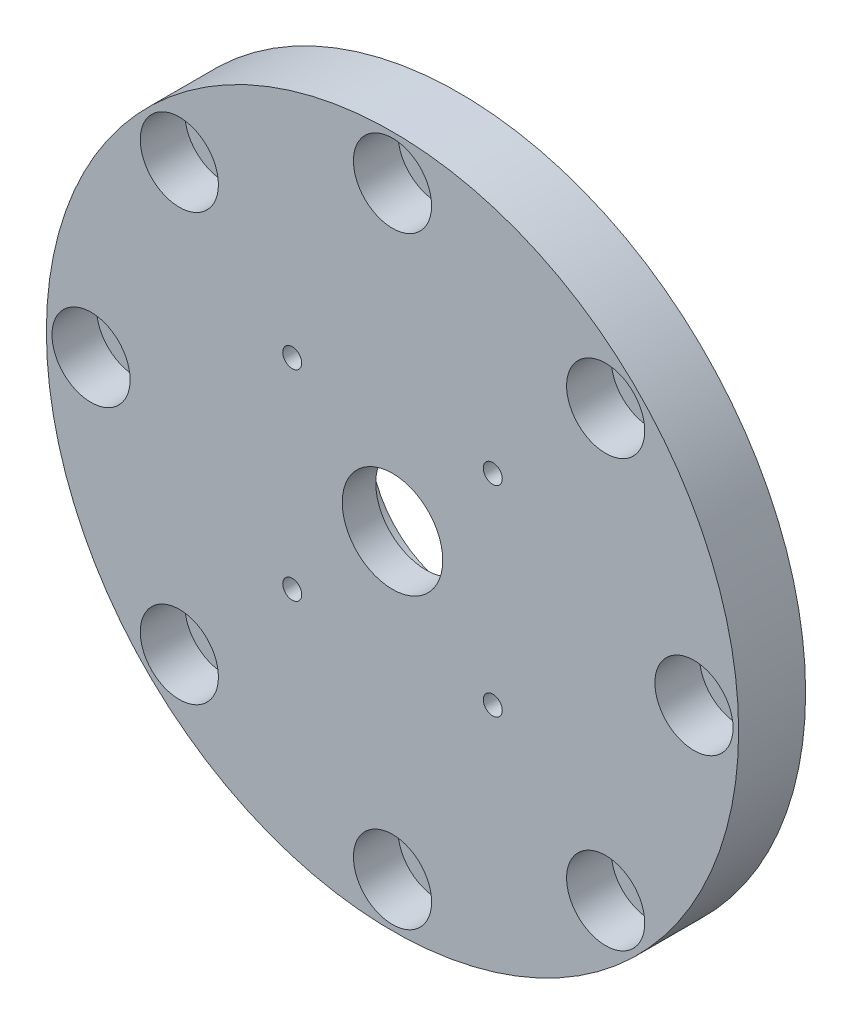
from build123d import *

# Parameters (mm, degrees)
SKETCH1_R           = 31
SKETCH1_R_2         = 4.5
SKETCH1_R_3         = 0.85
SKETCH1_R_4         = 1.55
BOSS_EXTRUDE2_DEPTH = 6
SKETCH5_R           = 8
CUT_EXTRUDE3_DEPTH  = 3
SKETCH6_R           = 3.5
CUT_EXTRUDE4_DEPTH  = 4
CUT_EXTRUDE5_DEPTH  = 2


with BuildPart() as part:
    # Sketch1 → Boss-Extrude2 (new body)
    with BuildSketch(Plane.XY):
        Circle(SKETCH1_R)
        Circle(SKETCH1_R_2, mode=Mode.SUBTRACT)
        with Locations((8.980256121, 8.980256121)):
            Circle(SKETCH1_R_3, mode=Mode.SUBTRACT)
        with Locations((8.980256121, -8.980256121)):
            Circle(SKETCH1_R_3, mode=Mode.SUBTRACT)
        with Locations((-8.980256121, -8.980256121)):
            Circle(SKETCH1_R_3, mode=Mode.SUBTRACT)
        with Locations((-8.980256121, 8.980256121)):
            Circle(SKETCH1_R_3, mode=Mode.SUBTRACT)
        with Locations((-27, 0)):
            Circle(SKETCH1_R_4, mode=Mode.SUBTRACT)
        with Locations((-19.091883092, 19.091883092)):
            Circle(SKETCH1_R_4, mode=Mode.SUBTRACT)
        with Locations((0, 27)):
            Circle(SKETCH1_R_4, mode=Mode.SUBTRACT)
        with Locations((19.091883092, 19.091883092)):
            Circle(SKETCH1_R_4, mode=Mode.SUBTRACT)
        with Locations((27, 0)):
            Circle(SKETCH1_R_4, mode=Mode.SUBTRACT)
        with Locations((19.091883092, -19.091883092)):
            Circle(SKETCH1_R_4, mode=Mode.SUBTRACT)
        with Locations((0, -27)):
            Circle(SKETCH1_R_4, mode=Mode.SUBTRACT)
        with Locations((-19.091883092, -19.091883092)):
            Circle(SKETCH1_R_4, mode=Mode.SUBTRACT)
    extrude(amount=BOSS_EXTRUDE2_DEPTH)

    # Sketch5 → Cut-Extrude3 (cut)
    with BuildSketch(Plane(origin=(0, 0, 0), x_dir=(-1, 0, 0), z_dir=(0, 0, -1))):
        Circle(SKETCH5_R)
    extrude(amount=-CUT_EXTRUDE3_DEPTH, mode=Mode.SUBTRACT)

    # Sketch6 → Cut-Extrude4 (cut)
    with BuildSketch(Plane.XY.offset(6)):
        with Locations((0, 27)):
            Circle(SKETCH6_R)
        with Locations((19.091883092, 19.091883092)):
            Circle(SKETCH6_R)
        with Locations((27, 0)):
            Circle(SKETCH6_R)
        with Locations((19.091883092, -19.091883092)):
            Circle(SKETCH6_R)
        with Locations((0, -27)):
            Circle(SKETCH6_R)
        with Locations((-19.091883092, -19.091883092)):
            Circle(SKETCH6_R)
        with Locations((-27, 0)):
            Circle(SKETCH6_R)
        with Locations((-19.091883092, 19.091883092)):
            Circle(SKETCH6_R)
    extrude(amount=-CUT_EXTRUDE4_DEPTH, mode=Mode.SUBTRACT)

    # Sketch7 → Cut-Extrude5 (cut)
    with BuildSketch(Plane(origin=(0, 0, 0), x_dir=(-1, 0, 0), z_dir=(0, 0, -1))):
        Polygon((-6.936436168, 10.160256121), (-8.980256121, 11.340256121), (-11.024076074, 10.160256121), (-11.024076074, 7.800256121), (-8.980256121, 6.620256121), (-6.936436168, 7.800256121), align=None)
        Polygon((10.160256121, 6.936436168), (11.340256121, 8.980256121), (10.160256121, 11.024076074), (7.800256121, 11.024076074), (6.620256121, 8.980256121), (7.800256121, 6.936436168), align=None)
        Polygon((6.936436168, -10.160256121), (8.980256121, -11.340256121), (11.024076074, -10.160256121), (11.024076074, -7.800256121), (8.980256121, -6.620256121), (6.936436168, -7.800256121), align=None)
        Polygon((-10.160256121, -6.936436168), (-11.340256121, -8.980256121), (-10.160256121, -11.024076074), (-7.800256121, -11.024076074), (-6.620256121, -8.980256121), (-7.800256121, -6.936436168), align=None)
    extrude(amount=-CUT_EXTRUDE5_DEPTH, mode=Mode.SUBTRACT)


solid = part.part
